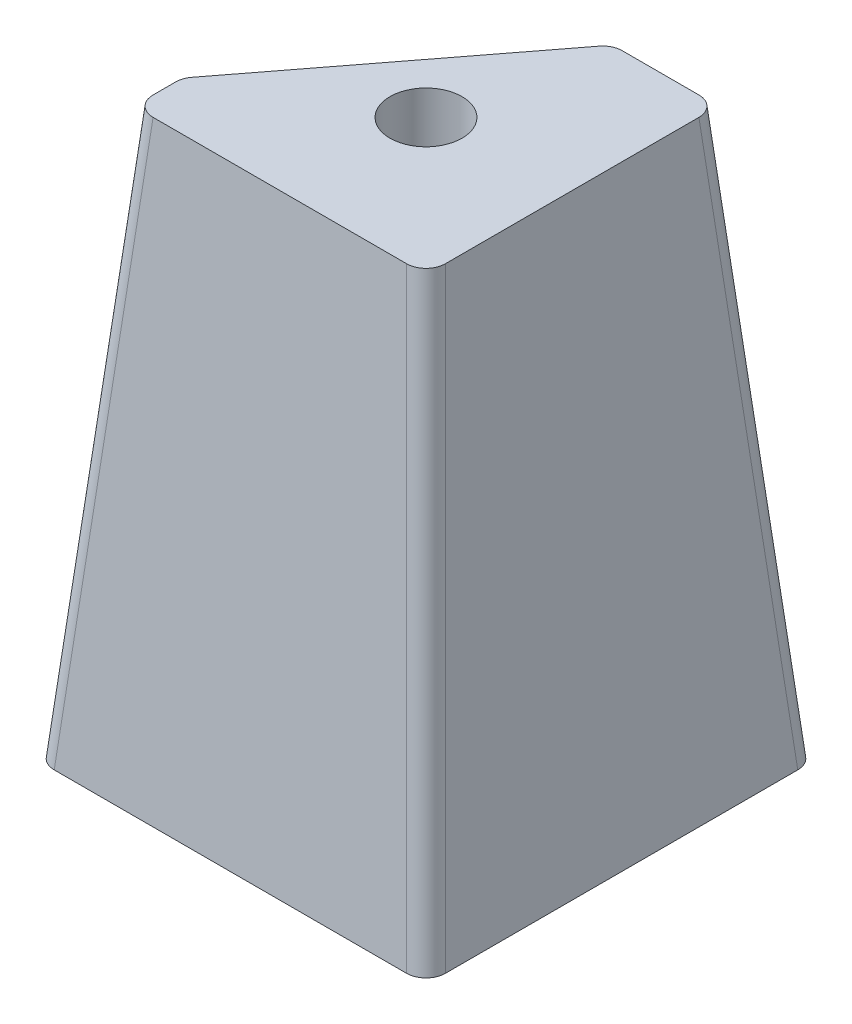
from build123d import *

# Parameters (mm, degrees)
BOSS_EXTRUDE1_DEPTH = 29
SKETCH2_R           = 1.5
SKETCH2_R_2         = 2
CUT_EXTRUDE1_DEPTH  = 10
SKETCH3_R           = 1.85
CUT_EXTRUDE2_DEPTH  = 12
DRAFT1_ANGLE        = 5
FILLET1_R           = 1


with BuildPart() as part:
    # Sketch1 → Boss-Extrude1 (new body)
    with BuildSketch(Plane(origin=(0, 0, 0), x_dir=(1, 0, 0), z_dir=(0, 1, 0))):
        Polygon((-4.579646018, -4.701327434), (4.994621907, 7.798672566), (10.420353982, 7.798672566), (10.420353982, -7.201327434), (-4.579646018, -7.201327434), align=None)
    extrude(amount=BOSS_EXTRUDE1_DEPTH)

    # Sketch2 → Cut-Extrude1 (cut)
    with BuildSketch(Plane.XZ):
        with Locations((-0.579646018, 2.201327434)):
            Circle(SKETCH2_R)
        with Locations((7.420353982, 2.201327434)):
            Circle(SKETCH2_R_2)
    extrude(amount=-CUT_EXTRUDE1_DEPTH, mode=Mode.SUBTRACT)

    # Sketch3 → Cut-Extrude2 (cut)
    with BuildSketch(Plane(origin=(0, 29, 0), x_dir=(1, 0, 0), z_dir=(0, 1, 0))):
        with Locations((3.420353982, -0.201327434)):
            Circle(SKETCH3_R)
    extrude(amount=-CUT_EXTRUDE2_DEPTH, mode=Mode.SUBTRACT)

    # Draft1
    draft1_faces = [part.faces().sort_by_distance(p)[0] for p in [
        (7.707487945, 14.5, -7.798672566),
        (10.420353982, 14.5, -0.298672566),
        (2.920353982, 14.5, 7.201327434),
        (-4.579646018, 14.5, 5.951327434),
        (0.207487945, 14.5, -1.548672566),
    ]]
    draft(draft1_faces, Plane.ZX.offset(29), DRAFT1_ANGLE)

    # Fillet1
    fillet1_edges = [part.edges().sort_by_distance(p)[0] for p in [
        (4.368336424, 14.5, -9.067258187),
        (-5.848231639, 14.5, 4.271317858),
        (11.688939603, 14.5, -9.067258187),
        (11.688939603, 14.5, 8.469913055),
        (-5.848231639, 14.5, 8.469913055),
    ]]
    fillet(fillet1_edges, radius=FILLET1_R)


solid = part.part
